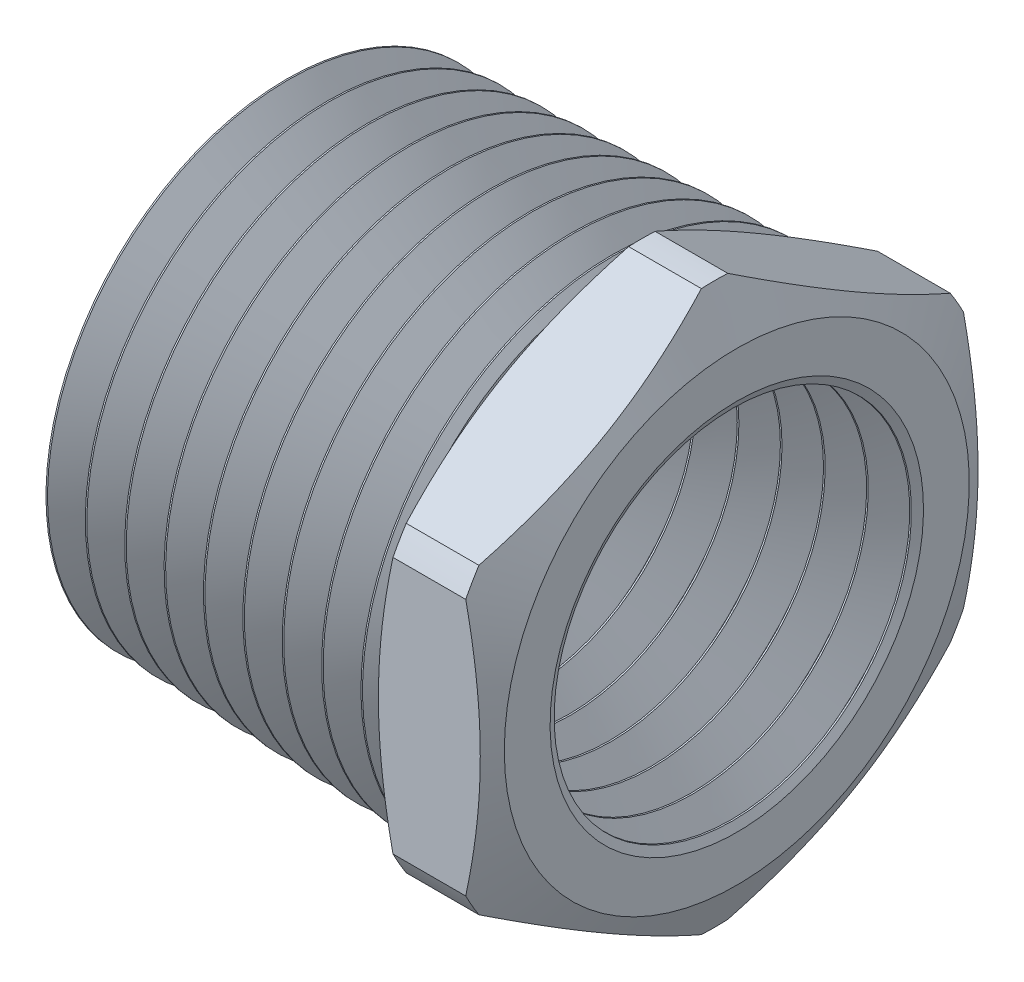
from build123d import *

# Parameters (mm, degrees)
EXTRUDE1_DEPTH = 4.064
SKETCH14_W     = 4.826
SKETCH14_H     = 5.445676263


# Read off the part's stored shape, not the designer's step: Cut-Revolve5
with BuildPart() as part:
    # Sketch1 → Revolve1 (revolve)
    with BuildSketch(Plane.XY):
        Polygon((0, 0), (0, 7.161072654), (0.025429996, 7.208479528), (0.64160868, 8.357166473), (0.695379235, 8.358846887), (1.382081969, 7.25087702), (1.435852524, 7.252557434), (2.052031208, 8.401244379), (2.105801763, 8.402924793), (2.792504496, 7.294954927), (2.846275051, 7.296635341), (3.462453735, 8.445322286), (3.51622429, 8.4470027), (4.202927024, 7.339032834), (4.256697579, 7.340713248), (4.872876263, 8.489400193), (4.926646818, 8.491080606), (5.613349551, 7.38311074), (5.667120106, 7.384791154), (6.28329879, 8.533478099), (6.337069345, 8.535158513), (7.023772079, 7.427188647), (7.077542634, 7.428869061), (7.693721318, 8.577556006), (7.747491873, 8.57923642), (8.434194606, 7.471266554), (8.487965161, 7.472946968), (9.104143845, 8.621633913), (9.1579144, 8.623314326), (9.844617134, 7.51534446), (9.898387689, 7.517024874), (10.514566373, 8.665711819), (10.568336928, 8.667392233), (11.255039661, 7.559422367), (11.308810216, 7.561102781), (11.9249889, 8.709789726), (11.978759455, 8.71147014), (12.665462189, 7.603500274), (12.719232744, 7.605180687), (13.335411428, 8.753867633), (13.389181983, 8.755548046), (14.075884716, 7.64757818), (14.129655271, 7.649258594), (14.745833955, 8.797945539), (14.79960451, 8.799625953), (15.486307244, 7.691656087), (15.540077799, 7.693336501), (16.156256483, 8.842023446), (16.210027038, 8.84370386), (16.896729771, 7.735733994), (16.950500326, 7.737414407), (16.950500326, 0), align=None)
    revolve(axis=Axis((0, 0, 0), (-1, 0, 0)))

    # Sketch5 → Cut-Revolve2 (revolve, cut)
    with BuildSketch(Plane.XY, mode=Mode.PRIVATE) as cut_revolve2_sk:
        Polygon((12.192, 0), (12.192, 8.71813424), (16.950500326, 8.866844806), (16.950500326, 0), align=None)
    revolve(cut_revolve2_sk.sketch.rotate(Axis((0, 0, 0), (-1, 0, 0)), 180), axis=Axis((0, 0, 0), (-1, 0, 0)), mode=Mode.SUBTRACT)

    # Sketch7 → Extrude1 (add)
    with BuildSketch(Plane(origin=(12.192, 0, 0), x_dir=(0, 0, -1), z_dir=(1, 0, 0))):
        Polygon((-8.636, -4.985996925), (-8.636, 4.985996925), (0, 9.971993849), (8.636, 4.985996925), (8.636, -4.985996925), (0, -9.971993849), align=None)
    extrude(amount=EXTRUDE1_DEPTH)

    # Sketch10 → Cut-Revolve4 (revolve, cut)
    with BuildSketch(Plane.XY, mode=Mode.PRIVATE) as cut_revolve4_sk:
        Polygon((16.256, 9.971993849), (12.192, 9.971993849), (12.192, 8.066993849), (12.961873944, 9.717993849), (15.486126056, 9.717993849), (16.256, 8.066993849), align=None)
    revolve(cut_revolve4_sk.sketch.rotate(Axis((0, 0, 0), (1, 0, 0)), 297.29455937), axis=Axis((0, 0, 0), (1, 0, 0)), mode=Mode.SUBTRACT)

    # Cut-Revolve5 outline → Cut-Revolve5 (revolve, cut)
    with BuildSketch(Plane.YX):
        Polygon((0, 16.256), (0, 4.826), (5.445676263, 4.826), (6.661157266, 5.429898935), (6.664521379, 5.48366949), (5.578673669, 6.204558764), (5.582037782, 6.258329319), (6.749270061, 6.838256384), (6.752634175, 6.892026939), (5.666786464, 7.612916212), (5.670150578, 7.666686767), (6.837382857, 8.246613832), (6.84074697, 8.300384387), (5.75489926, 9.021273661), (5.758263373, 9.075044216), (6.925495653, 9.654971281), (6.928859766, 9.708741836), (5.843012056, 10.42963111), (5.846376169, 10.483401665), (7.013608448, 11.063328729), (7.016972562, 11.117099284), (5.931124851, 11.837988558), (5.934488965, 11.891759113), (7.101721244, 12.471686178), (7.105085357, 12.525456733), (6.019237647, 13.246346007), (6.02260176, 13.300116562), (7.18983404, 13.880043627), (7.193198153, 13.933814182), (6.107350443, 14.654703455), (6.110714556, 14.70847401), (7.277946835, 15.288401075), (7.281310949, 15.34217163), (6.195463238, 16.063060904), (6.198827352, 16.116831459), (6.478935012, 16.256), align=None)
    revolve(axis=Axis((0, 0, 0), (1, 0, 0)), mode=Mode.SUBTRACT)

    # Sketch14 → Cut-Revolve6 (revolve, cut)
    with BuildSketch(Plane.XY, mode=Mode.PRIVATE) as cut_revolve6_sk:
        with Locations((2.413, 2.722838132)):
            Rectangle(SKETCH14_W, SKETCH14_H)
    revolve(cut_revolve6_sk.sketch.rotate(Axis((0, 0, 0), (-1, 0, 0)), 180), axis=Axis((0, 0, 0), (-1, 0, 0)), mode=Mode.SUBTRACT)


solid = part.part
